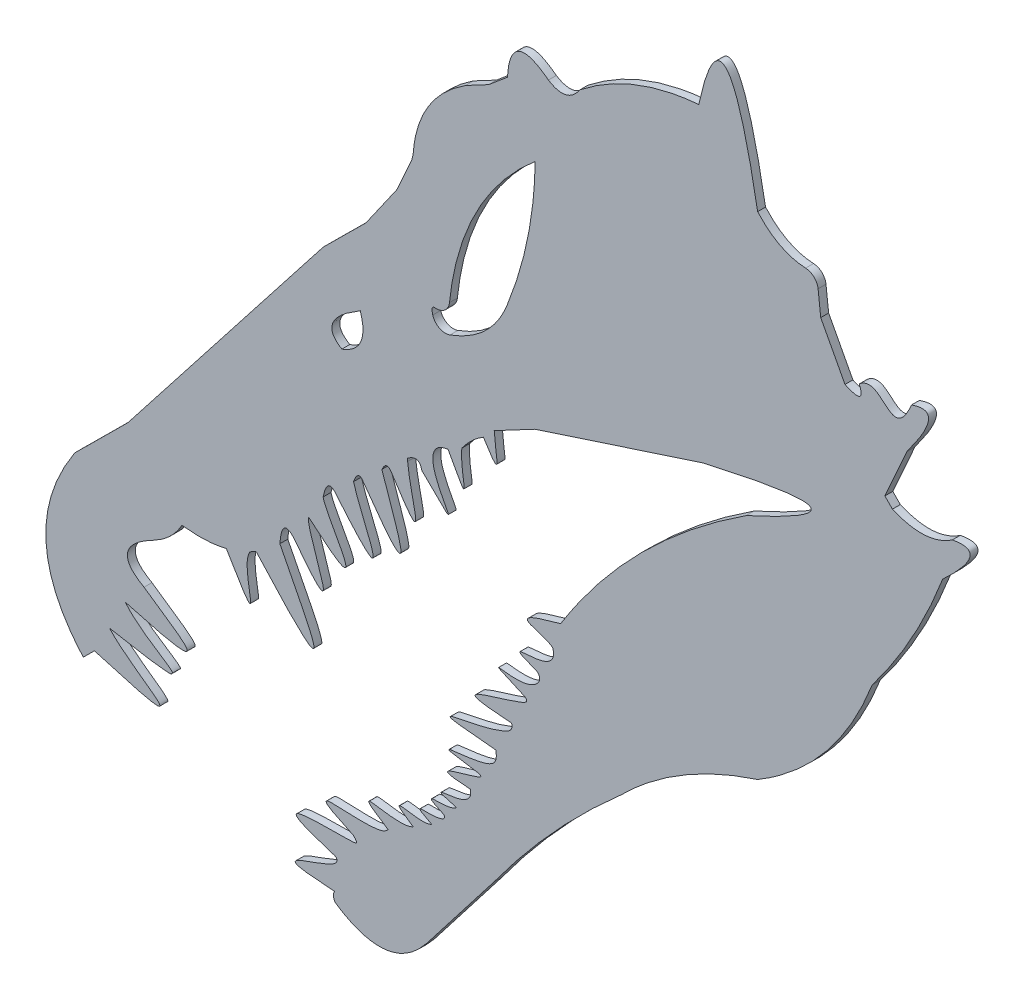
from build123d import *

# Parameters (mm, degrees)
BOSS_EXTRUDE4_DEPTH = 3
FILLET1_R           = 5
FILLET2_R           = 5
FILLET3_R           = 5
FILLET4_R           = 5
SKETCH5_R           = 33.808492901
BOSS_EXTRUDE5_DEPTH = 3
SKETCH6_R           = 29.609182467
BOSS_EXTRUDE6_DEPTH = 3


with BuildPart() as part:
    # Sketch1 → Boss-Extrude4 (new body)
    with BuildSketch(Plane.XY):
        with BuildLine():
            add(Edge.make_bspline(
                [(12.406689794, 79.048501717), (57.924646876, 65.420854695), (29.004071293, 77.489771305), (18.122959514, 89.350872726)],
                knots=[0, 0, 0, 0, 0.624242156, 0.624242156, 0.624242156, 0.624242156], degree=3))
            add(Edge.make_bspline(
                [(18.122959514, 89.350872726), (33.192444173, 86.54749588), (39.79725525, 85.582181691), (41.572548894, 86.016326825)],
                knots=[0, 0, 0, 0, 0.240955183, 0.240955183, 0.240955183, 0.240955183], degree=3))
            Line((41.572548894, 86.016326825), (42.067986531, 86.559685106))
            add(Edge.make_bspline(
                [(42.067986531, 86.559685106), (41.527878689, 88.369632823), (29.788525022, 93.839113432), (24.12110056, 100.884256355)],
                knots=[0.298412888, 0.298412888, 0.298412888, 0.298412888, 0.703488295, 0.703488295, 0.703488295, 0.703488295], degree=3))
            add(Edge.make_bspline(
                [(24.12110056, 100.884256355), (65.489019005, 89.06872436), (41.729453691, 101.483900106), (31.21276231, 109.344848476)],
                knots=[0, 0, 0, 0, 0.667966377, 0.667966377, 0.667966377, 0.667966377], degree=3))
            add(Edge.make_bspline(
                [(31.21276231, 109.344848476), (16.887476442, 117.405378095), (35.137026429, 126.729794887)],
                knots=[0, 0, 0, 1, 1, 1], degree=2))
            add(Edge.make_bspline(
                [(35.137026429, 126.729794887), (42.057436172, 130.450556722), (45.610446711, 136.873343665)],
                knots=[0, 0, 0, 1, 1, 1], degree=2))
            add(Edge.make_bspline(
                [(45.610446711, 136.873343665), (54.48404383, 135.695851956), (62.38217862, 137.644958795)],
                knots=[0, 0, 0, 0.414929014, 0.414929014, 0.414929014], degree=2))
            add(Edge.make_bspline(
                [(62.38217862, 137.644958795), (79.356880476, 108.705394654), (66.873264062, 133.86542073), (71.347170317, 141.025377361)],
                knots=[0, 0, 0, 0, 0.78922185, 0.78922185, 0.78922185, 0.78922185], degree=3))
            add(Edge.make_bspline(
                [(71.347170317, 141.025377361), (72.135289447, 141.433290074), (72.914936161, 141.868358665), (73.686110623, 142.330583231)],
                knots=[0.659305127, 0.659305127, 0.659305127, 0.659305127, 0.726282897, 0.726282897, 0.726282897, 0.726282897], degree=3))
            add(Edge.make_bspline(
                [(73.686110623, 142.330583231), (107.3943205, 104.610651981), (95.413046228, 124.020287869), (82.71626457, 149.358076494)],
                knots=[0, 0, 0, 0, 0.401296981, 0.401296981, 0.401296981, 0.401296981], degree=3))
            add(Edge.make_bspline(
                [(82.71626457, 149.358076494), (83.342747059, 158.766891884), (87.745617499, 154.146373229)],
                knots=[0, 0, 0, 1, 1, 1], degree=2))
            add(Edge.make_bspline(
                [(87.745617499, 154.146373229), (109.957198874, 124.794914392), (92.917508487, 156.545031162), (93.492402104, 163.642361504)],
                knots=[0, 0, 0, 0, 0.735410005, 0.735410005, 0.735410005, 0.735410005], degree=3))
            add(Edge.make_bspline(
                [(93.492402104, 163.642361504), (120.729788563, 139.890206837), (100.675502653, 165.79639033), (99.1166208, 172.86679509), (99.108002681, 172.908242088)],
                knots=[0, 0, 0, 0, 0.6960658, 0.700238314, 0.700238314, 0.700238314, 0.700238314], degree=3))
            add(Edge.make_bspline(
                [(99.108002681, 172.908242088), (100.518444676, 180.087938768), (103.601714093, 176.761073653)],
                knots=[0, 0, 0, 1, 1, 1], degree=2))
            add(Edge.make_bspline(
                [(103.601714093, 176.761073653), (129.149033796, 145.827621467), (113.834171239, 171.822547615), (110.635423044, 183.703056321)],
                knots=[0, 0, 0, 0, 0.60984951, 0.60984951, 0.60984951, 0.60984951], degree=3))
            add(Edge.make_bspline(
                [(110.635423044, 183.703056321), (112.429796, 188.717276107), (114.398117259, 185.397479855)],
                knots=[0, 0, 0, 1, 1, 1], degree=2))
            add(Edge.make_bspline(
                [(114.398117259, 185.397479855), (137.829942545, 151.806120643), (126.304724135, 177.456841528), (121.393207732, 193.077505367), (121.386155743, 193.099956586)],
                knots=[0, 0, 0, 0, 0.913008962, 0.914324326, 0.914324326, 0.914324326, 0.914324326], degree=3))
            add(Edge.make_bspline(
                [(121.386155743, 193.099956586), (122.987094319, 196.546350133), (124.661641054, 194.409354407)],
                knots=[0, 0, 0, 1, 1, 1], degree=2))
            add(Edge.make_bspline(
                [(124.661641054, 194.409354407), (139.942376429, 170.579185667), (132.583652603, 186.58311889), (131.150090273, 200.484628036), (131.140462185, 200.580723926)],
                knots=[0, 0, 0, 0, 0.533021791, 0.536736482, 0.536736482, 0.536736482, 0.536736482], degree=3))
            Line((131.140462185, 200.580723926), (131.140462185, 201.639642211))
            add(Edge.make_bspline(
                [(131.140462185, 201.639642211), (135.521762584, 204.90384938), (136.532410371, 200.29210585)],
                knots=[0, 0, 0, 1, 1, 1], degree=2))
            add(Edge.make_bspline(
                [(136.532410371, 200.29210585), (162.389422596, 174.342746618), (127.920352472, 209.711145235), (146.473770816, 212.246087278)],
                knots=[0, 0, 0, 0, 1, 1, 1, 1], degree=3))
            add(Edge.make_bspline(
                [(146.473770816, 212.246087278), (156.894070588, 192.699195307), (150.627069559, 206.203999834), (151.708541135, 215.26536656)],
                knots=[0, 0, 0, 0, 0.666811839, 0.666811839, 0.666811839, 0.666811839], degree=3))
            add(Edge.make_bspline(
                [(151.708541135, 215.26536656), (155.078456095, 220.018886789), (159.880507652, 222.936689538)],
                knots=[0, 0, 0, 1, 1, 1], degree=2))
            add(Edge.make_bspline(
                [(159.880507652, 222.936689538), (167.941482881, 209.745073784), (164.232695848, 219.500743335), (163.982220878, 227.122176532)],
                knots=[0, 0, 0, 0, 0.544771224, 0.544771224, 0.544771224, 0.544771224], degree=3))
            Line((163.982220878, 227.122176532), (179.484639346, 235.337560702))
            Line((179.484639346, 235.337560702), (243.225679766, 256.109428462))
            add(Edge.make_bspline(
                [(243.225679766, 256.109428462), (315.908465831, 272.689007059), (259.507429701, 247.000697243)],
                knots=[0, 0, 0, 1, 1, 1], degree=2))
            add(Edge.make_bspline(
                [(259.507429701, 247.000697243), (215.181683039, 218.234093284), (189.15786261, 176.338287568)],
                knots=[0, 0, 0, 0.705042095, 0.705042095, 0.705042095], degree=2))
            add(Edge.make_bspline(
                [(189.15786261, 176.338287568), (164.784727183, 169.934331294), (182.663456486, 170.655811283), (186.219696862, 166.782428928)],
                knots=[0, 0, 0, 0, 0.747299325, 0.747299325, 0.747299325, 0.747299325], degree=3))
            add(Edge.make_bspline(
                [(180.329406793, 156.09771671), (161.278814739, 163.413564358), (189.268291234, 155.341306726), (186.219696862, 166.782428928)],
                knots=[0, 0, 0, 0, 1, 1, 1, 1], degree=3))
            add(Edge.make_bspline(
                [(175.370470507, 145.686971471), (154.534046103, 154.912602399), (176.403873853, 144.382235206), (182.05425545, 154.58651795), (180.329406793, 156.09771671)],
                knots=[0, 0, 0, 0, 0.819418709, 1, 1, 1, 1], degree=3))
            add(Edge.make_bspline(
                [(170.586690341, 134.394339925), (145.516853398, 135.998679623), (161.824235588, 137.959056801), (177.585067511, 144.377913571), (175.370470507, 145.686971471)],
                knots=[0, 0, 0, 0, 0.862127877, 1, 1, 1, 1], degree=3))
            add(Edge.make_bspline(
                [(164.573768129, 122.577277522), (129.687826271, 125.478810305), (159.578966399, 124.711162589), (171.070720699, 132.225958303), (170.586690341, 134.394339925)],
                knots=[0, 0, 0, 0, 0.893539801, 1, 1, 1, 1], degree=3))
            add(Edge.make_bspline(
                [(158.226794683, 111.637099609), (135.072954359, 114.975779225), (157.899119701, 112.984663204), (165.327793882, 118.596007877), (164.573768129, 122.577277522)],
                knots=[0, 0, 0, 0, 0.778202833, 1, 1, 1, 1], degree=3))
            add(Edge.make_bspline(
                [(154.929997012, 104.874867427), (138.906445041, 105.803379989), (149.751887835, 107.398131616), (159.660694235, 110.979563238), (158.226794683, 111.637099609)],
                knots=[0, 0, 0, 0, 0.884033063, 1, 1, 1, 1], degree=3))
            add(Edge.make_bspline(
                [(149.652478032, 96.234223608), (133.075996461, 100.628202637), (157.076980378, 95.911961951), (154.929997012, 104.874867427)],
                knots=[0, 0, 0, 0, 1, 1, 1, 1], degree=3))
            add(Edge.make_bspline(
                [(144.944103257, 91.47410845), (133.096151374, 96.786995015), (146.341797196, 92.955783496), (149.652478032, 96.234223608)],
                knots=[0, 0, 0, 0, 1, 1, 1, 1], degree=3))
            add(Edge.make_bspline(
                [(140.287468863, 85.989627942), (131.440334865, 90.54910821), (139.194433477, 87.741883829), (145.710106644, 90.198931254), (144.944103257, 91.47410845)],
                knots=[0, 0, 0, 0, 0.77148113, 1, 1, 1, 1], degree=3))
            add(Edge.make_bspline(
                [(133.239505619, 81.695176224), (119.960846807, 90.3446804), (135.120120398, 83.229004689), (140.287468863, 85.989627942)],
                knots=[0, 0, 0, 0, 1, 1, 1, 1], degree=3))
            add(Edge.make_bspline(
                [(123.751974843, 76.012553452), (105.474755395, 87.539955043), (126.104358736, 77.76555094), (133.239505619, 81.695176224)],
                knots=[0, 0, 0, 0, 1, 1, 1, 1], degree=3))
            add(Edge.make_bspline(
                [(110.635423044, 67.515577656), (87.404287139, 78.036393989), (111.927986176, 71.61209305), (122.711525346, 74.78858625), (123.751974843, 76.012553452)],
                knots=[0, 0, 0, 0, 0.875810572, 1, 1, 1, 1], degree=3))
            add(Edge.make_bspline(
                [(103.601714093, 57.316058647), (74.015610446, 66.2504857), (98.08752647, 64.603420445), (112.757233499, 65.429098826), (110.635423044, 67.515577656)],
                knots=[0, 0, 0, 0, 0.91083762, 1, 1, 1, 1], degree=3))
            add(Edge.make_bspline(
                [(103.4199346, 54.686116923), (105.247201884, 56.451218934), (103.601714093, 57.316058647)],
                knots=[0, 0, 0, 1, 1, 1], degree=2))
            add(Edge.make_bspline(
                [(103.4199346, 45.600863693), (74.268184316, 47.234988813), (95.558844824, 49.565056131), (103.4199346, 54.686116923)],
                knots=[0, 0, 0, 0, 1, 1, 1, 1], degree=3))
            add(Edge.make_bspline(
                [(103.601714093, 42.115614596), (102.570669112, 43.976961897), (103.4199346, 45.600863693)],
                knots=[0, 0, 0, 1, 1, 1], degree=2))
            add(Edge.make_bspline(
                [(138.398060644, 46.014185843), (124.243825788, 28.16349602), (103.601714093, 42.115614596)],
                knots=[0, 0, 0, 1, 1, 1], degree=2))
            Line((138.398060644, 46.014185843), (163.982220878, 79.048501717))
            add(Edge.make_bspline(
                [(212.043814681, 131.563350139), (184.926951081, 107.840872043), (163.982220878, 79.048501717)],
                knots=[0, 0, 0, 1, 1, 1], degree=2))
            add(Edge.make_bspline(
                [(263.843646955, 162.526313713), (232.893381151, 152.477300392), (212.043814681, 131.563350139)],
                knots=[0, 0, 0, 0.737465088, 0.737465088, 0.737465088], degree=2))
            add(Edge.make_bspline(
                [(307.260375946, 215.26536656), (293.696909213, 180.187229729), (263.843646955, 162.526313713)],
                knots=[0, 0, 0, 1, 1, 1], degree=2))
            add(Edge.make_bspline(
                [(334.002384244, 263.391982648), (323.953036444, 237.178617273), (307.260375946, 215.26536656)],
                knots=[0, 0, 0, 1, 1, 1], degree=2))
            add(Edge.make_bspline(
                [(337.665867841, 278.110418485), (352.721473429, 280.774103548), (334.002384244, 263.391982648)],
                knots=[0, 0, 0, 1, 1, 1], degree=2))
            add(Edge.make_bspline(
                [(314.938830808, 276.834338412), (327.661348925, 271.352823182), (337.665867841, 278.110418485)],
                knots=[0, 0, 0, 1, 1, 1], degree=2))
            Line((314.938830808, 276.834338412), (312.068732912, 279.727682972))
            Line((312.068732912, 279.727682972), (320.452778666, 298.507294573))
            add(Edge.make_bspline(
                [(322.179765131, 314.66079746), (335.924993219, 319.333977103), (320.452778666, 298.507294573)],
                knots=[0, 0, 0, 1, 1, 1], degree=2))
            add(Edge.make_bspline(
                [(302.339561673, 311.629068975), (311.043790255, 319.150591154), (314.64315454, 297.043549311), (322.179765131, 314.66079746)],
                knots=[0, 0, 0, 0, 1, 1, 1, 1], degree=3))
            add(Edge.make_bspline(
                [(296.953520523, 308.774779027), (305.252983368, 304.969318334), (302.339561673, 311.629068975)],
                knots=[0, 0, 0, 1, 1, 1], degree=2))
            Line((296.953520523, 308.774779027), (287.757455288, 326.127741299))
            Line((287.757455288, 326.127741299), (286.235014956, 339.640559299))
            add(Edge.make_bspline(
                [(286.235014956, 339.640559299), (273.459803923, 338.234323442), (263.843646955, 348.944931871)],
                knots=[0.501913658, 0.501913658, 0.501913658, 1.501913658, 1.501913658, 1.501913658], degree=2))
            add(Edge.make_bspline(
                [(241.531639237, 372.966855), (251.293794973, 418.955972582), (263.843646955, 348.944931871)],
                knots=[0, 0, 0, 1, 1, 1], degree=2))
            add(Edge.make_bspline(
                [(196.46221829, 355.261549139), (216.239351309, 370.904953595), (241.531639237, 372.966855)],
                knots=[0, 0, 0, 1, 1, 1], degree=2))
            add(Edge.make_bspline(
                [(184.517262266, 352.494532068), (191.635641905, 348.055305504), (196.46221829, 355.261549139)],
                knots=[0, 0, 0, 1, 1, 1], degree=2))
            add(Edge.make_bspline(
                [(168.980826412, 345.652360666), (170.003165134, 363.668374211), (184.517262266, 352.494532068)],
                knots=[0, 0, 0, 1, 1, 1], degree=2))
            Line((168.980826412, 345.652360666), (161.832435046, 339.640559298))
            Line((161.832435046, 339.640559298), (153.164741587, 335.047183641))
            add(Edge.make_bspline(
                [(153.164741587, 335.047183641), (134.656853322, 323.215564794), (133.239505619, 302.480701638)],
                knots=[0, 0, 0, 1, 1, 1], degree=2))
            Line((133.239505619, 302.480701638), (132.798835107, 300.619520092))
            Line((132.798835107, 300.619520092), (127.088224669, 287.828196048))
            Line((127.088224669, 287.828196048), (115.38416543, 271.07011123))
            Line((115.38416543, 271.07011123), (99.135855336, 254.952348669))
            Line((99.135855336, 254.952348669), (25.125295008, 160.32603767))
            Line((25.125295008, 160.32603767), (4.958907462, 140.321677569))
            add(Edge.make_bspline(
                [(4.958907462, 140.321677569), (-18.51462183, 104.756275755), (8.202192202, 74.844004126)],
                knots=[0, 0, 0, 1, 1, 1], degree=2))
            Line((8.202192202, 74.844004126), (12.406689794, 79.048501717))
        make_face()
        with BuildLine():
            add(Edge.make_bspline(
                [(244.197259184, 324.314652154), (251.49109448, 336.979680811), (263.843646955, 325.104830685)],
                knots=[0.097727058, 0.097727058, 0.097727058, 1.097727058, 1.097727058, 1.097727058], degree=2))
            add(Edge.make_bspline(
                [(275.371583445, 276.448729152), (290.011600821, 304.189647388), (263.843646955, 325.104830685)],
                knots=[0, 0, 0, 1, 1, 1], degree=2))
            add(Edge.make_bspline(
                [(245.453321174, 276.834338412), (261.371777697, 272.286031106), (275.371583445, 276.448729152)],
                knots=[0, 0, 0, 0.654711443, 0.654711443, 0.654711443], degree=2))
            add(Edge.make_bspline(
                [(245.453321174, 276.834338412), (224.088215161, 286.959013764), (223.66952626, 302.785783364), (244.197259184, 324.314652154)],
                knots=[0.620811949, 0.620811949, 0.620811949, 0.620811949, 1.537254597, 1.537254597, 1.537254597, 1.537254597], degree=3))
        make_face(mode=Mode.SUBTRACT)
        with BuildLine():
            add(Edge.make_bspline(
                [(113.209050478, 241.106291364), (96.009302514, 231.015247827), (106.237821281, 225.025069747)],
                knots=[0, 0, 0, 1, 1, 1], degree=2))
            add(Edge.make_bspline(
                [(113.209050478, 241.106291364), (117.05322182, 228.992118762), (106.237821281, 225.025069747)],
                knots=[0, 0, 0, 1, 1, 1], degree=2))
        make_face(mode=Mode.SUBTRACT)
        with BuildLine():
            add(Edge.make_bspline(
                [(179.484639346, 323.292640846), (148.429034382, 296.639357642), (146.473770816, 253.602906077)],
                knots=[0, 0, 0, 1, 1, 1], degree=2))
            add(Edge.make_bspline(
                [(168.980826412, 271.07011123), (179.219242603, 296.684865663), (179.484639346, 323.292640846)],
                knots=[0, 0, 0, 0.949466597, 0.949466597, 0.949466597], degree=2))
            add(Edge.make_bspline(
                [(142.667526442, 248.713898098), (162.4099978, 253.938796487), (168.980826412, 271.07011123)],
                knots=[0, 0, 0, 1, 1, 1], degree=2))
            add(Edge.make_bspline(
                [(146.473770816, 253.602906077), (136.689154568, 260.644014871), (142.667526442, 248.713898098)],
                knots=[0, 0, 0, 1, 1, 1], degree=2))
        make_face(mode=Mode.SUBTRACT)
        with BuildLine():
            add(Edge.make_bspline(
                [(214.264574898, 345.652360666), (241.458979778, 322.425177938), (212.043814681, 293.573276768)],
                knots=[0, 0, 0, 1, 1, 1], degree=2))
            add(Edge.make_bspline(
                [(212.043814681, 293.573276768), (192.724284221, 305.980080576), (200.738141388, 325.104830685)],
                knots=[0, 0, 0, 1, 1, 1], degree=2))
            add(Edge.make_bspline(
                [(200.738141388, 325.104830685), (189.853370506, 337.200239847), (205.870174174, 342.539733283)],
                knots=[0, 0, 0, 1, 1, 1], degree=2))
            add(Edge.make_bspline(
                [(205.870174174, 342.539733283), (213.732326793, 340.069008143), (214.264574898, 345.652360666)],
                knots=[0, 0, 0, 1, 1, 1], degree=2))
        make_face(mode=Mode.SUBTRACT)
    extrude(amount=BOSS_EXTRUDE4_DEPTH)

    # Fillet1
    fillet1_edges = [part.edges().sort_by_distance(p)[0] for p in [
        (142.667526442, 248.713898098, 1.5),
    ]]
    fillet(fillet1_edges, radius=FILLET1_R)

    # Fillet2
    fillet2_edges = [part.edges().sort_by_distance(p)[0] for p in [
        (146.473770816, 253.602906077, 1.5),
    ]]
    fillet(fillet2_edges, radius=FILLET2_R)

    # Fillet3
    fillet3_edges = [part.edges().sort_by_distance(p)[0] for p in [
        (286.235014956, 339.640559299, 1.5),
    ]]
    fillet(fillet3_edges, radius=FILLET3_R)

    # Fillet4
    fillet4_edges = [part.edges().sort_by_distance(p)[0] for p in [
        (200.738141388, 325.104830685, 1.5),
    ]]
    fillet(fillet4_edges, radius=FILLET4_R)

    # Sketch5 → Boss-Extrude5 (add)
    with BuildSketch(Plane.XY):
        with Locations((258.645260792, 301.12801075)):
            Circle(SKETCH5_R)
    extrude(amount=BOSS_EXTRUDE5_DEPTH)

    # Sketch6 → Boss-Extrude6 (add)
    with BuildSketch(Plane.XY):
        with Locations((215.576778181, 321.68407492)):
            Circle(SKETCH6_R)
    extrude(amount=BOSS_EXTRUDE6_DEPTH)


solid = part.part
